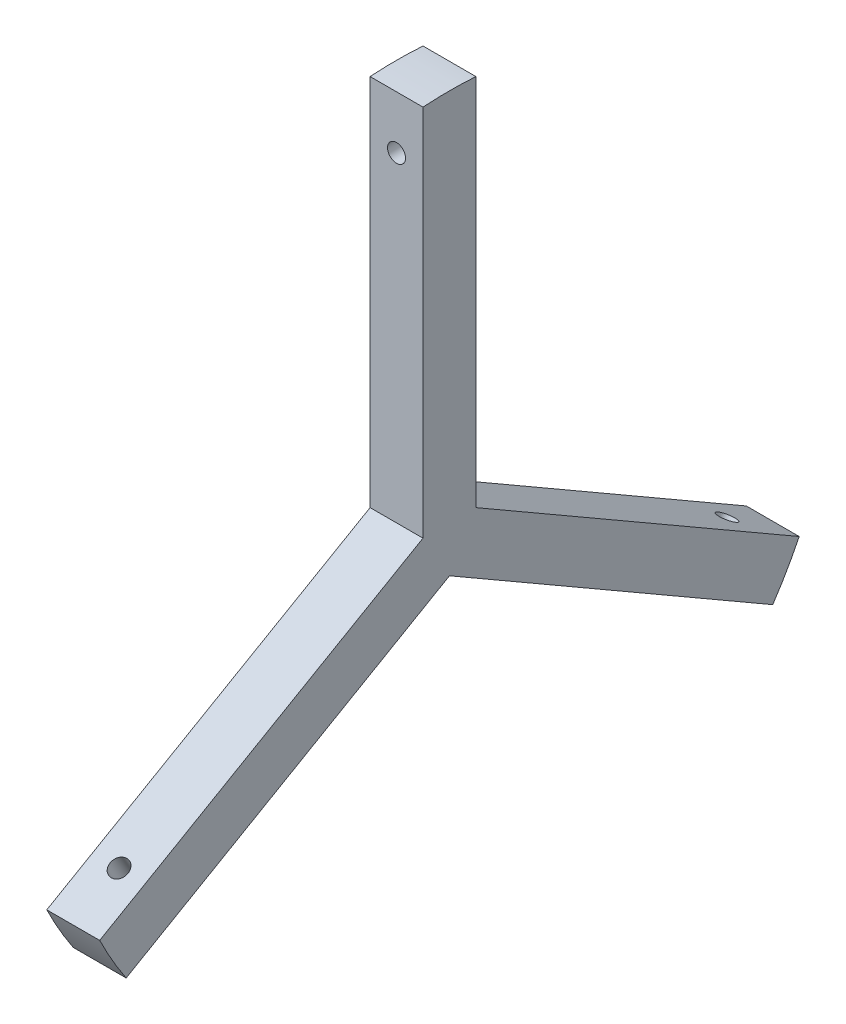
from build123d import *

# Parameters (mm, degrees)
ESQUISSE2_W                  = 10
ESQUISSE2_H                  = 73.61
BOSS_EXTRU_1_DEPTH           = 5
ENL_V_MAT_EXTRU_1_DEPTH      = 75.454228221
D_GAGEMENT_M31_D             = 3.4
R_P_TITION_CIRCULAIRE1_COUNT = 3


with BuildPart() as part:
    # Esquisse2 → Boss.-Extru.1 (new, symmetric)
    with BuildSketch(Plane.XY):
        with Locations((0, 36.805)):
            Rectangle(ESQUISSE2_W, ESQUISSE2_H)
    boss_extru_1 = extrude(amount=BOSS_EXTRU_1_DEPTH, both=True)

    # Esquisse3 → Enlèv. mat.-Extru.1 (cut, through all)
    with BuildSketch(Plane(origin=(5, 0, 0), x_dir=(0, 0, -1), z_dir=(1, 0, 0))):
        with BuildLine():
            Line((-25.399222728, 69.089156782), (-25.399222728, 83.587655611))
            Line((-25.399222728, 83.587655611), (25.399222728, 83.587655611))
            Line((25.399222728, 83.587655611), (25.399222728, 69.089156782))
            ThreePointArc((25.399222728, 69.089156782), (0, 73.61), (-25.399222728, 69.089156782))
        make_face()
    enl_v_mat_extru_1 = extrude(amount=-ENL_V_MAT_EXTRU_1_DEPTH, mode=Mode.SUBTRACT)

    # Dégagement M31 (through all)
    with Locations(Plane(origin=(0, 0, -5), x_dir=(-1, 0, 0), z_dir=(0, 0, -1))):
        with Locations((0, 63.439989788)):
            d_gagement_m31 = Hole(D_GAGEMENT_M31_D / 2)

    # Répétition circulaire1: Boss.-Extru.1, Enlèv. mat.-Extru.1, Dégagement M31 ×3 about axis
    r_p_tition_circulaire1_axis = Axis((0, 0, 0), (1, 0, 0))
    add([boss_extru_1.rotate(r_p_tition_circulaire1_axis, i * 360 / R_P_TITION_CIRCULAIRE1_COUNT) for i in range(1, R_P_TITION_CIRCULAIRE1_COUNT)])
    add([enl_v_mat_extru_1.rotate(r_p_tition_circulaire1_axis, i * 360 / R_P_TITION_CIRCULAIRE1_COUNT) for i in range(1, R_P_TITION_CIRCULAIRE1_COUNT)], mode=Mode.SUBTRACT)
    add([d_gagement_m31.rotate(r_p_tition_circulaire1_axis, i * 360 / R_P_TITION_CIRCULAIRE1_COUNT) for i in range(1, R_P_TITION_CIRCULAIRE1_COUNT)], mode=Mode.SUBTRACT)


solid = part.part
